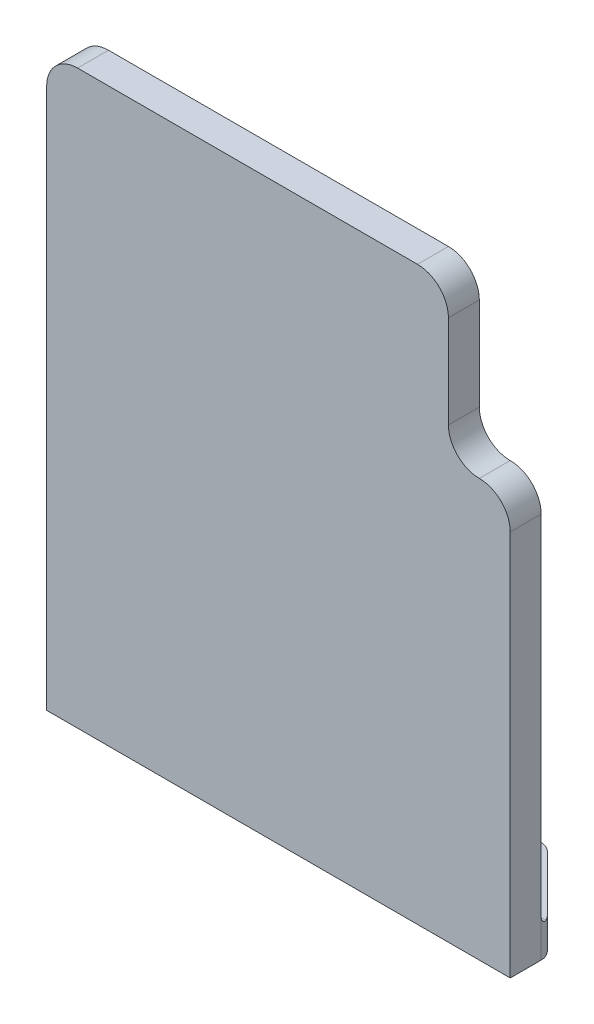
from build123d import *

# Parameters (mm, degrees)
SKETCH2_W           = 170
SKETCH2_H           = 185
BOSS_EXTRUDE1_DEPTH = 9.8
SKETCH4_R           = 3
SKETCH4_R_2         = 2.5
SKETCH4_R_3         = 20
SKETCH4_R_4         = 9
SKETCH4_R_5         = 13
SKETCH4_R_6         = 10
SKETCH4_R_7         = 2.75
SKETCH4_R_8         = 11
SKETCH4_R_9         = 12.5
SKETCH4_W           = 20
SKETCH4_H           = 185
SKETCH4_H_2         = 35
SKETCH4_H_3         = 50
HOLES_DEPTH         = 9.8
FEET_DEPTH          = 23
SKETCH7_R           = 3
FEET_HOLE_DEPTH     = 10
MOTOR_SINK_START    = -9.8
SKETCH9_R           = 6
MOTOR_SINK_DEPTH    = 4
BOSS_EXTRUDE2_DEPTH = 0.2
FILLET4_R           = 10
CUT_EXTRUDE2_DEPTH  = 129.534392285
FILLET6_R           = 2
CUT_EXTRUDE3_DEPTH  = 198.296325359
FILLET7_R           = 5


# Some blends are built 0.0001 mm under size
with BuildPart() as part:
    # Sketch2 → Boss-Extrude1 (new body)
    with BuildSketch(Plane.XY):
        Rectangle(SKETCH2_W, SKETCH2_H)
    extrude(amount=-BOSS_EXTRUDE1_DEPTH)

    # Sketch4 → holes (cut)
    with BuildSketch(Plane.XY):
        with Locations((50, 77.5)):
            Circle(SKETCH4_R)
        with Locations(Location((50, -72.5, 0), (0, 0, 180))):
            Circle(SKETCH4_R)
        with Locations(Location((-25, -22.5, 0), (0, 0, 180))):
            Circle(SKETCH4_R_2)
        with Locations((-50, 77.5)):
            Circle(SKETCH4_R)
        with Locations((50, 2.5)):
            Circle(SKETCH4_R_3)
        with Locations(Location((25, -22.5, 0), (0, 0, 180))):
            Circle(SKETCH4_R)
        with Locations((-50, 62.5)):
            Circle(SKETCH4_R)
        with Locations(Location((-25, 27.5, 0), (0, 0, 180))):
            Circle(SKETCH4_R_2)
        with Locations((0, 2.5)):
            Circle(SKETCH4_R_3)
        with Locations((0, 35.804729394)):
            Circle(SKETCH4_R)
        with Locations((0, -30.804729394)):
            Circle(SKETCH4_R)
        with Locations(Location((75, -22.5, 0), (0, 0, 180))):
            Circle(SKETCH4_R)
        with Locations(Location((75, 27.5, 0), (0, 0, 180))):
            Circle(SKETCH4_R)
        with Locations(Location((25, 27.5, 0), (0, 0, 180))):
            Circle(SKETCH4_R)
        with Locations(Location((35, -72.5, 0), (0, 0, 180))):
            Circle(SKETCH4_R)
        with Locations(Location((-50, -30.804729394, 0), (0, 0, 180))):
            Circle(SKETCH4_R)
        with Locations(Location((-20, 77.5, 0), (0, 0, 180))):
            Circle(SKETCH4_R)
        with Locations((20, 77.5)):
            Circle(SKETCH4_R)
        with Locations(Location((-50, 35.804729394, 0), (0, 0, 180))):
            Circle(SKETCH4_R)
        with Locations((-44.446789408, 17.751552332)):
            Circle(SKETCH4_R_4)
        with Locations((0, 61.5)):
            Circle(SKETCH4_R_5)
        with Locations((-46.819261128, -11.562260058)):
            Circle(SKETCH4_R_6)
        with Locations((-35, -72.5)):
            Circle(SKETCH4_R)
        with Locations((-33.304729394, 2.5)):
            Circle(SKETCH4_R_7)
        with Locations((35, -50)):
            Circle(SKETCH4_R_8)
        with Locations((-40, -52.5)):
            Circle(SKETCH4_R_9)
        with Locations(Location((-50, -72.5, 0), (0, 0, 180))):
            Circle(SKETCH4_R)
        with Locations(Location((-35, 62.5, 0), (0, 0, 180))):
            Circle(SKETCH4_R)
        with Locations(Location((-35, 52.5, 0), (0, 0, 180))):
            Circle(SKETCH4_R)
        with Locations((50, -30.804729394)):
            Circle(SKETCH4_R)
        with Locations((35, 77.5)):
            Circle(SKETCH4_R)
        with Locations(Location((-35, 77.5, 0), (0, 0, 180))):
            Circle(SKETCH4_R)
        with Locations((65, -50)):
            Circle(SKETCH4_R_8)
        with Locations(Location((50, 62.5, 0), (0, 0, 180))):
            Circle(SKETCH4_R)
        with Locations((50, 35.804729394)):
            Circle(SKETCH4_R)
        with Locations(Location((65, -72.5, 0), (0, 0, 180))):
            Circle(SKETCH4_R)
        with Locations(Location((80, -72.5, 0), (0, 0, 180))):
            Circle(SKETCH4_R)
        with Locations((-50, 52.5)):
            Circle(SKETCH4_R)
        with Locations((35, 62.5)):
            Circle(SKETCH4_R)
        with Locations(Location((-20, 52.5, 0), (0, 0, 180))):
            Circle(SKETCH4_R)
        with Locations((20, 52.5)):
            Circle(SKETCH4_R)
        with Locations(Location((-20, 62.5, 0), (0, 0, 180))):
            Circle(SKETCH4_R)
        with Locations((20, 62.5)):
            Circle(SKETCH4_R)
        with Locations((35, 52.5)):
            Circle(SKETCH4_R)
        with Locations(Location((50, 52.5, 0), (0, 0, 180))):
            Circle(SKETCH4_R)
        with Locations((-75, 0)):
            Rectangle(SKETCH4_W, SKETCH4_H)
        with Locations((0, -65)):
            Rectangle(SKETCH4_W, SKETCH4_H_2)
        with Locations((75, 67.5)):
            Rectangle(SKETCH4_W, SKETCH4_H_3)
    extrude(amount=-HOLES_DEPTH, mode=Mode.SUBTRACT)

    # Sketch6 → feet (add)
    with BuildSketch(Plane(origin=(0, 0, -9.8), x_dir=(-1, 0, 0), z_dir=(0, 0, -1))):
        Polygon((-10, -82.5), (-10, -92.5), (-85, -92.5), (-85, -82.5), (-18, -82.5), (-18, -42.5), (-10, -42.5), align=None)
        Polygon((10, -82.5), (10, -42.5), (18, -42.5), (18, -82.5), (65, -82.5), (65, -92.5), (10, -92.5), align=None)
    extrude(amount=FEET_DEPTH)

    # Sketch7 → feet-hole (cut)
    with BuildSketch(Plane.XZ.offset(92.5)):
        with Locations((60, -25)):
            Circle(SKETCH7_R)
        with Locations((30, -25)):
            Circle(SKETCH7_R)
        with Locations((-30, -25)):
            Circle(SKETCH7_R)
        with Locations((-60, -25)):
            Circle(SKETCH7_R)
    extrude(amount=-FEET_HOLE_DEPTH, mode=Mode.SUBTRACT)

    # Sketch9 → motor_sink (cut)
    with BuildSketch(Plane(origin=(0, 0, -9.8), x_dir=(-1, 0, 0), z_dir=(0, 0, -1)).offset(MOTOR_SINK_START)):
        with Locations((-75, -22.5)):
            Circle(SKETCH9_R)
        with Locations((-25, -22.5)):
            Circle(SKETCH9_R)
        with Locations((-25, 27.5)):
            Circle(SKETCH9_R)
        with Locations((-75, 27.5)):
            Circle(SKETCH9_R)
        with Locations((-50, -30.804729394)):
            Circle(SKETCH9_R)
        with Locations((25, 27.5)):
            Circle(SKETCH9_R)
        with Locations((25, -22.5)):
            Circle(SKETCH9_R)
        with Locations((0, -30.804729394)):
            Circle(SKETCH9_R)
        with Locations((-50, 35.804729394)):
            Circle(SKETCH9_R)
        with Locations((33.304729394, 2.5)):
            Circle(SKETCH9_R)
        with Locations((0, 35.804729394)):
            Circle(SKETCH9_R)
    extrude(amount=MOTOR_SINK_DEPTH, mode=Mode.SUBTRACT)

    # Sketch13 → Boss-Extrude2 (add)
    with BuildSketch(Plane.XY):
        Polygon((-65, 92.5), (65, 92.5), (65, 42.5), (85, 42.5), (85, -92.5), (-65, -92.5), align=None)
    extrude(amount=BOSS_EXTRUDE2_DEPTH)

    # Fillet4
    fillet4_edges = [part.edges().sort_by_distance(p)[0] for p in [
        (65, 42.5, -4.8),
        (-65, 92.5, -4.8),
        (85, 42.5, -4.8),
        (65, 92.5, -4.8),
    ]]
    fillet(fillet4_edges, radius=FILLET4_R - 0.0001)  # a hair under: the kernel refuses the full size

    # Sketch14 → Cut-Extrude2 (cut, through all)
    with BuildSketch(Plane(origin=(18, 0, 0), x_dir=(0, 0, -1), z_dir=(1, 0, 0))):
        Polygon((32.8, -82.5), (9.8, -42.5), (32.8, -42.5), align=None)
    extrude(amount=-CUT_EXTRUDE2_DEPTH, mode=Mode.SUBTRACT)

    # Fillet6
    fillet6_edges = [part.edges().sort_by_distance(p)[0] for p in [
        (14, -42.5, -9.8),
        (51.5, -82.5, -9.8),
        (-41.5, -82.5, -9.8),
        (-14, -42.5, -9.8),
    ]]
    fillet(fillet6_edges, radius=FILLET6_R)

    # Sketch16 → Cut-Extrude3 (cut, through all)
    with BuildSketch(Plane(origin=(0, -82.5, 0), x_dir=(1, 0, 0), z_dir=(0, 1, 0))):
        Polygon((85, 11.8), (64, 32.8), (85, 32.8), align=None)
    extrude(amount=-CUT_EXTRUDE3_DEPTH, mode=Mode.SUBTRACT)

    # Fillet7
    # the kernel refuses this fillet: 5 mm, written as the material it takes off along each edge
    with BuildSketch(Plane(origin=(85, -77.32233047, -11.8), x_dir=(0, 0, 1), z_dir=(0, -1, 0))) as fillet7_piece_1:
        with BuildLine():
            CenterArc((FILLET7_R * 0.414213562373, FILLET7_R), FILLET7_R, 225, 45)
            Line((-FILLET7_R * 0.292893218813, FILLET7_R * 0.292893218813), (0, 0))
            Line((0, 0), (FILLET7_R * 0.414213562373, 0))
        make_face()
    extrude(amount=20.355339059, mode=Mode.SUBTRACT)
    with BuildSketch(Plane(origin=(64, -77.32233047, -32.8), x_dir=(-1, 0, 0), z_dir=(0, -1, 0))) as fillet7_piece_2:
        with BuildLine():
            CenterArc((FILLET7_R * 0.414213562373, -FILLET7_R), FILLET7_R, 90, 45)
            Line((-FILLET7_R * 0.292893218813, -FILLET7_R * 0.292893218813), (0, 0))
            Line((0, 0), (FILLET7_R * 0.414213562373, 0))
        make_face()
    extrude(amount=20.355339059, mode=Mode.SUBTRACT)
    with BuildSketch(Plane(origin=(-65, -70, -32.8), x_dir=(0, 0, 1), z_dir=(0, -1, 0))) as fillet7_piece_3:
        with BuildLine():
            CenterArc((FILLET7_R, -FILLET7_R), FILLET7_R, 90, 90)
            Line((0, -FILLET7_R), (0, 0))
            Line((0, 0), (FILLET7_R, 0))
        make_face()
    extrude(amount=35, mode=Mode.SUBTRACT)


solid = part.part
